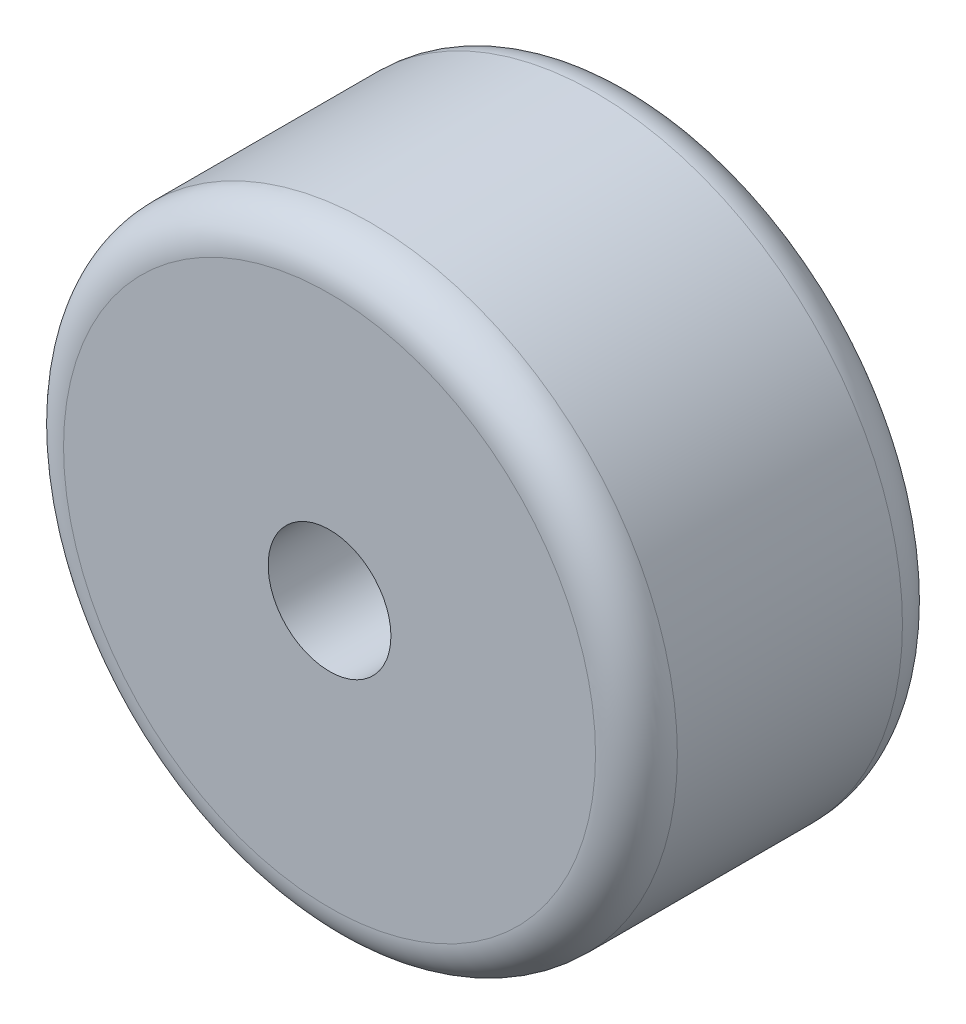
from build123d import *

# Parameters (mm, degrees)
SKETCH1_R           = 150
BOSS_EXTRUDE1_DEPTH = 150
SKETCH2_R           = 30
CUT_EXTRUDE1_DEPTH  = 50
FILLET1_R           = 20
SKETCH3_R           = 10
CUT_EXTRUDE2_DEPTH  = 5
FILLET4_R           = 50


with BuildPart() as part:
    # Sketch1 → Boss-Extrude1 (new body)
    with BuildSketch(Plane.XY):
        Circle(SKETCH1_R)
    extrude(amount=BOSS_EXTRUDE1_DEPTH)

    # Sketch2 → Cut-Extrude1 (cut)
    with BuildSketch(Plane.XY.offset(150)):
        Circle(SKETCH2_R)
    extrude(amount=-CUT_EXTRUDE1_DEPTH, mode=Mode.SUBTRACT)

    # Fillet1
    fillet1_edges = [part.edges().sort_by_distance(p)[0] for p in [
        (-150, 0, 0),
        (-150, 0, 150),
    ]]
    fillet(fillet1_edges, radius=FILLET1_R)

    # Sketch3 → Cut-Extrude2 (cut)
    with BuildSketch(Plane(origin=(0, 0, 0), x_dir=(-1, 0, 0), z_dir=(0, 0, -1))):
        Circle(SKETCH3_R)
    extrude(amount=-CUT_EXTRUDE2_DEPTH, mode=Mode.SUBTRACT)

    # Fillet4
    # the kernel refuses this fillet: 50 mm, written as the material it takes off along each edge
    with BuildSketch(Plane(origin=(0, 0, 0), x_dir=(-1, 0, 0), z_dir=(0, -1, 0))) as fillet4_piece_1:
        with BuildLine():
            CenterArc((31.794494718, -50), FILLET4_R, 90, 25.841932763)
            Line((10, -5), (9.564110106, -4.1))
            ThreePointArc((9.564110106, -4.1), (9, -2.5), (9, 0))
            Line((9, 0), (10, 1))
            Line((10, 1), (31.794494718, 1))
            Line((31.794494718, 1), (31.794494718, 0))
        make_face()
    revolve(axis=Axis((0, 0, 0), (0, 0, -1)), mode=Mode.SUBTRACT)


solid = part.part
